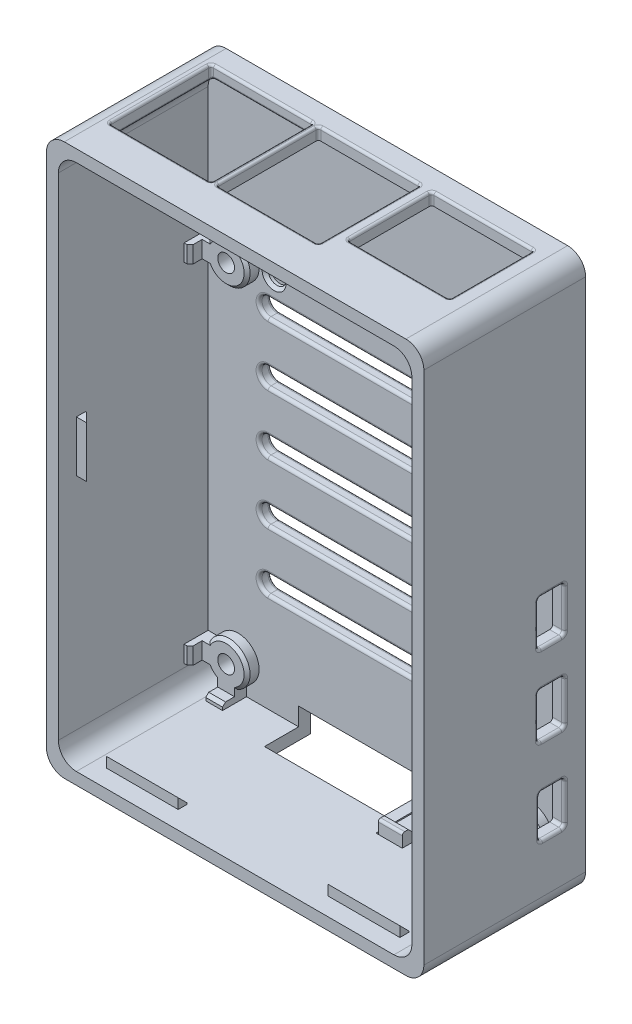
from build123d import *

# Parameters (mm, degrees)
BOSS_EXTRUDE1_DEPTH      = 25
BOSS_EXTRUDE2_START      = -2
BOSS_EXTRUDE2_DEPTH      = 2
CUT_EXTRUDE1_DEPTH       = 2
SKETCH2_24_R             = 1.4
BOSS_EXTRUDE10_DEPTH     = 2
SKETCH2_29_W             = 2.8
SKETCH2_29_H             = 1
SKETCH2_29_W_2           = 1
SKETCH2_29_H_2           = 2.8
BOSS_EXTRUDE13_DEPTH     = 4
CHAMFER4_SIZE            = 0.5
CHAMFER5_SIZE            = 0.5
FILLET2_R                = 0.5
SKETCH2_34_R             = 1.5
CUT_EXTRUDE10_DEPTH      = 1
CHAMFER6_SIZE            = 0.5
SKETCH5_W                = 4
SKETCH5_H                = 3
BOSS_EXTRUDE15_DEPTH     = 2
FILLET4_R                = 0.4
CHAMFER8_SIZE            = 2
CUT_EXTRUDE12_DEPTH      = 1.5
CUT_EXTRUDE12_DEPTH_BACK = 4
SKETCH5_6_W              = 0.2
SKETCH5_6_H              = 2
CUT_EXTRUDE15_DEPTH      = 3
CUT_EXTRUDE15_DEPTH_BACK = 4
SKETCH5_10_W             = 20
SKETCH5_10_H             = 5.7
SKETCH5_10_H_2           = 2
CUT_EXTRUDE16_DEPTH      = 4
CUT_EXTRUDE16_DEPTH_BACK = 4
SKETCH6_W                = 17
SKETCH6_H                = 14
SKETCH6_H_2              = 17
FILLET6_R                = 0.4
CUT_EXTRUDE18_DEPTH      = 4
CUT_EXTRUDE18_DEPTH_BACK = 4
SKETCH7_W                = 7.4
SKETCH7_H                = 4.4
FILLET7_R                = 0.5
SKETCH10_W               = 8.5
SKETCH10_H               = 1.5
BOSS_EXTRUDE18_DEPTH     = 4
SKETCH7_6_W              = 8.5
SKETCH7_6_H              = 1.5
BOSS_EXTRUDE19_DEPTH     = 4
SKETCH6_3_W              = 12
SKETCH6_3_H              = 1.5
BOSS_EXTRUDE20_DEPTH     = 4
SKETCH5_11_W             = 12
SKETCH5_11_H             = 1.5
BOSS_EXTRUDE21_DEPTH     = 2
CHAMFER9_SIZE            = 1.8


# Some blends are built 0.0001 mm under size
with BuildPart() as part:
    # Sketch2 → Boss-Extrude1 (new body)
    with BuildSketch(Plane(origin=(0, 0, 0), x_dir=(0, 1, 0), z_dir=(0, 0, 1))):
        with BuildLine():
            Line((0.99045979, 60.9958194), (86.99045979, 60.9958194))
            ThreePointArc((86.99045979, 60.9958194), (89.111780134, 60.117139744), (89.99045979, 57.9958194))
            Line((89.99045979, 57.9958194), (89.99045979, 0.9958194))
            ThreePointArc((89.99045979, 0.9958194), (89.111780134, -1.125500943), (86.99045979, -2.0041806))
            Line((86.99045979, -2.0041806), (0.99045979, -2.0041806))
            ThreePointArc((0.99045979, -2.0041806), (-1.130860553, -1.125500943), (-2.00954021, 0.9958194))
            Line((-2.00954021, 0.9958194), (-2.00954021, 57.9958194))
            ThreePointArc((-2.00954021, 57.9958194), (-1.130860553, 60.117139744), (0.99045979, 60.9958194))
        make_face()
        with BuildLine():
            Line((2.99045979, 58.9958194), (84.99045979, 58.9958194))
            ThreePointArc((84.99045979, 58.9958194), (87.111780134, 58.117139744), (87.99045979, 55.9958194))
            Line((87.99045979, 55.9958194), (87.99045979, 2.9958194))
            ThreePointArc((87.99045979, 2.9958194), (87.111780134, 0.874499057), (84.99045979, -0.0041806))
            Line((84.99045979, -0.0041806), (2.99045979, -0.0041806))
            ThreePointArc((2.99045979, -0.0041806), (0.869139447, 0.874499057), (-0.00954021, 2.9958194))
            Line((-0.00954021, 2.9958194), (-0.00954021, 55.9958194))
            ThreePointArc((-0.00954021, 55.9958194), (0.869139447, 58.117139744), (2.99045979, 58.9958194))
        make_face(mode=Mode.SUBTRACT)
    extrude(amount=BOSS_EXTRUDE1_DEPTH)

    # Sketch2<6> → Boss-Extrude2 (add)
    with BuildSketch(Plane(origin=(0, 0, 0), x_dir=(0, 1, 0), z_dir=(0, 0, 1)).offset(BOSS_EXTRUDE2_START)):
        with BuildLine():
            Line((0.99045979, 60.9958194), (86.99045979, 60.9958194))
            ThreePointArc((86.99045979, 60.9958194), (89.111780134, 60.117139744), (89.99045979, 57.9958194))
            Line((89.99045979, 57.9958194), (89.99045979, 0.9958194))
            ThreePointArc((89.99045979, 0.9958194), (89.111780134, -1.125500943), (86.99045979, -2.0041806))
            Line((86.99045979, -2.0041806), (0.99045979, -2.0041806))
            ThreePointArc((0.99045979, -2.0041806), (-1.130860553, -1.125500943), (-2.00954021, 0.9958194))
            Line((-2.00954021, 0.9958194), (-2.00954021, 57.9958194))
            ThreePointArc((-2.00954021, 57.9958194), (-1.130860553, 60.117139744), (0.99045979, 60.9958194))
        make_face()
    extrude(amount=BOSS_EXTRUDE2_DEPTH)

    # Sketch2<7> → Cut-Extrude1 (cut)
    with BuildSketch(Plane(origin=(0, 0, 0), x_dir=(0, 1, 0), z_dir=(0, 0, 1))):
        with BuildLine():
            Line((69.49045979, 48.9958194), (69.49045979, 9.9958194))
            ThreePointArc((69.49045979, 9.9958194), (67.99045979, 8.4958194), (66.49045979, 9.9958194))
            Line((66.49045979, 9.9958194), (66.49045979, 48.9958194))
            ThreePointArc((66.49045979, 48.9958194), (67.99045979, 50.4958194), (69.49045979, 48.9958194))
        make_face()
        with BuildLine():
            Line((56.49045979, 48.9958194), (56.49045979, 9.9958194))
            ThreePointArc((56.49045979, 9.9958194), (57.99045979, 8.4958194), (59.49045979, 9.9958194))
            Line((59.49045979, 9.9958194), (59.49045979, 48.9958194))
            ThreePointArc((59.49045979, 48.9958194), (57.99045979, 50.4958194), (56.49045979, 48.9958194))
        make_face()
        with BuildLine():
            Line((49.49045979, 48.9958194), (49.49045979, 9.9958194))
            ThreePointArc((49.49045979, 9.9958194), (47.99045979, 8.4958194), (46.49045979, 9.9958194))
            Line((46.49045979, 9.9958194), (46.49045979, 48.9958194))
            ThreePointArc((46.49045979, 48.9958194), (47.99045979, 50.4958194), (49.49045979, 48.9958194))
        make_face()
        with BuildLine():
            Line((36.49045979, 48.9958194), (36.49045979, 9.9958194))
            ThreePointArc((36.49045979, 9.9958194), (37.99045979, 8.4958194), (39.49045979, 9.9958194))
            Line((39.49045979, 9.9958194), (39.49045979, 48.9958194))
            ThreePointArc((39.49045979, 48.9958194), (37.99045979, 50.4958194), (36.49045979, 48.9958194))
        make_face()
        with BuildLine():
            Line((29.49045979, 48.9958194), (29.49045979, 9.9958194))
            ThreePointArc((29.49045979, 9.9958194), (27.99045979, 8.4958194), (26.49045979, 9.9958194))
            Line((26.49045979, 9.9958194), (26.49045979, 48.9958194))
            ThreePointArc((26.49045979, 48.9958194), (27.99045979, 50.4958194), (29.49045979, 48.9958194))
        make_face()
        with BuildLine():
            Line((16.49045979, 48.9958194), (16.49045979, 9.9958194))
            ThreePointArc((16.49045979, 9.9958194), (17.99045979, 8.4958194), (19.49045979, 9.9958194))
            Line((19.49045979, 9.9958194), (19.49045979, 48.9958194))
            ThreePointArc((19.49045979, 48.9958194), (17.99045979, 50.4958194), (16.49045979, 48.9958194))
        make_face()
    extrude(amount=-CUT_EXTRUDE1_DEPTH, mode=Mode.SUBTRACT)

    # Sketch2<24> → Boss-Extrude10 (add)
    # profile 1 of 4: a face of its own
    with BuildSketch(Plane(origin=(0, 0, 0), x_dir=(0, 1, 0), z_dir=(0, 0, 1))):
        with BuildLine():
            Line((6.39045979, 57.9958194), (3.59045979, 57.9958194))
            Line((3.59045979, 57.9958194), (3.59045979, 57.203622387))
            ThreePointArc((3.59045979, 57.203622387), (2.515586056, 56.470693134), (1.782656804, 55.3958194))
            Line((1.782656804, 55.3958194), (0.99045979, 55.3958194))
            Line((0.99045979, 55.3958194), (0.99045979, 52.5958194))
            Line((0.99045979, 52.5958194), (1.782656804, 52.5958194))
            ThreePointArc((1.782656804, 52.5958194), (7.465333524, 51.520945666), (6.39045979, 57.203622387))
            Line((6.39045979, 57.203622387), (6.39045979, 57.9958194))
        make_face()
        with Locations(Location((4.99045979, 53.9958194, 0), (0, 0, 270))):
            Circle(SKETCH2_24_R, mode=Mode.SUBTRACT)
    # profile 2 of 4: a face of its own
    with BuildSketch(Plane(origin=(0, 0, 0), x_dir=(0, 1, 0), z_dir=(0, 0, 1))):
        with BuildLine():
            Line((64.39045979, 57.9958194), (61.59045979, 57.9958194))
            Line((61.59045979, 57.9958194), (61.59045979, 57.203622387))
            ThreePointArc((61.59045979, 57.203622387), (62.99045979, 50.4958194), (64.39045979, 57.203622387))
            Line((64.39045979, 57.203622387), (64.39045979, 57.9958194))
        make_face()
        with Locations(Location((62.99045979, 53.9958194, 0), (0, 0, 270))):
            Circle(SKETCH2_24_R, mode=Mode.SUBTRACT)
    # profile 3 of 4: a face of its own
    with BuildSketch(Plane(origin=(0, 0, 0), x_dir=(0, 1, 0), z_dir=(0, 0, 1))):
        with BuildLine():
            Line((61.59045979, 0.9958194), (64.39045979, 0.9958194))
            Line((64.39045979, 0.9958194), (64.39045979, 1.788016414))
            ThreePointArc((64.39045979, 1.788016414), (62.99045979, 8.4958194), (61.59045979, 1.788016414))
            Line((61.59045979, 1.788016414), (61.59045979, 0.9958194))
        make_face()
        with Locations(Location((62.99045979, 4.9958194, 0), (0, 0, 270))):
            Circle(SKETCH2_24_R, mode=Mode.SUBTRACT)
    # profile 4 of 4: a face of its own
    with BuildSketch(Plane(origin=(0, 0, 0), x_dir=(0, 1, 0), z_dir=(0, 0, 1))):
        with BuildLine():
            Line((1.782656804, 6.3958194), (0.99045979, 6.3958194))
            Line((0.99045979, 6.3958194), (0.99045979, 3.5958194))
            Line((0.99045979, 3.5958194), (1.782656804, 3.5958194))
            ThreePointArc((1.782656804, 3.5958194), (2.515586056, 2.520945666), (3.59045979, 1.788016414))
            Line((3.59045979, 1.788016414), (3.59045979, 0.9958194))
            Line((3.59045979, 0.9958194), (6.39045979, 0.9958194))
            Line((6.39045979, 0.9958194), (6.39045979, 1.788016414))
            ThreePointArc((6.39045979, 1.788016414), (7.465333524, 7.470693134), (1.782656804, 6.3958194))
        make_face()
        with Locations(Location((4.99045979, 4.9958194, 0), (0, 0, 270))):
            Circle(SKETCH2_24_R, mode=Mode.SUBTRACT)
    extrude(amount=BOSS_EXTRUDE10_DEPTH)

    # Sketch2<29> → Boss-Extrude13 (add)
    with BuildSketch(Plane(origin=(0, 0, 0), x_dir=(0, 1, 0), z_dir=(0, 0, 1))):
        with Locations((4.99045979, 58.4958194)):
            Rectangle(SKETCH2_29_W, SKETCH2_29_H)
        with Locations((0.49045979, 53.9958194)):
            Rectangle(SKETCH2_29_W_2, SKETCH2_29_H_2)
        with Locations((0.49045979, 4.9958194)):
            Rectangle(SKETCH2_29_W_2, SKETCH2_29_H_2)
        with Locations((4.99045979, 0.4958194)):
            Rectangle(SKETCH2_29_W, SKETCH2_29_H)
        with Locations((62.99045979, 0.4958194)):
            Rectangle(SKETCH2_29_W, SKETCH2_29_H)
        with Locations((62.99045979, 58.4958194)):
            Rectangle(SKETCH2_29_W, SKETCH2_29_H)
    extrude(amount=BOSS_EXTRUDE13_DEPTH)

    # Chamfer4
    chamfer4_edges = [part.edges().sort_by_distance(p)[0] for p in [
        (-57.9958194, 62.99045979, 4),
        (-0.9958194, 62.99045979, 4),
        (-0.9958194, 4.99045979, 4),
        (-4.9958194, 0.99045979, 4),
        (-53.9958194, 0.99045979, 4),
        (-57.9958194, 4.99045979, 4),
    ]]
    chamfer(chamfer4_edges, length=CHAMFER4_SIZE)

    # Chamfer5
    chamfer5_edges = [part.edges().sort_by_distance(p)[0] for p in [
        (-7.470693134, 7.465333524, 2),
        (-2.520945666, 2.515586056, 2),
        (-8.4958194, 62.99045979, 2),
        (-50.4958194, 62.99045979, 2),
        (-51.520945666, 7.465333524, 2),
        (-56.470693134, 2.515586056, 2),
    ]]
    chamfer(chamfer5_edges, length=CHAMFER5_SIZE)

    # Fillet2
    fillet2_edges = [part.edges().sort_by_distance(p)[0] for p in [
        (-50.4958194, 67.99045979, -2),
        (-29.4958194, 69.49045979, 0),
        (-8.4958194, 67.99045979, -2),
        (-29.4958194, 66.49045979, -2),
        (-29.4958194, 69.49045979, -2),
        (-50.4958194, 67.99045979, 0),
        (-29.4958194, 66.49045979, 0),
        (-8.4958194, 67.99045979, 0),
        (-50.4958194, 57.99045979, 0),
        (-29.4958194, 59.49045979, 0),
        (-8.4958194, 57.99045979, 0),
        (-29.4958194, 56.49045979, -2),
        (-50.4958194, 57.99045979, -2),
        (-29.4958194, 59.49045979, -2),
        (-8.4958194, 57.99045979, -2),
        (-29.4958194, 56.49045979, 0),
        (-50.4958194, 47.99045979, -2),
        (-29.4958194, 49.49045979, 0),
        (-8.4958194, 47.99045979, -2),
        (-29.4958194, 46.49045979, -2),
        (-29.4958194, 49.49045979, -2),
        (-50.4958194, 47.99045979, 0),
        (-29.4958194, 46.49045979, 0),
        (-8.4958194, 47.99045979, 0),
        (-50.4958194, 37.99045979, 0),
        (-29.4958194, 39.49045979, 0),
        (-8.4958194, 37.99045979, 0),
        (-29.4958194, 36.49045979, -2),
        (-50.4958194, 37.99045979, -2),
        (-29.4958194, 39.49045979, -2),
        (-8.4958194, 37.99045979, -2),
        (-29.4958194, 36.49045979, 0),
        (-50.4958194, 27.99045979, -2),
        (-29.4958194, 29.49045979, 0),
        (-8.4958194, 27.99045979, -2),
        (-29.4958194, 26.49045979, -2),
        (-29.4958194, 29.49045979, -2),
        (-50.4958194, 27.99045979, 0),
        (-29.4958194, 26.49045979, 0),
        (-8.4958194, 27.99045979, 0),
        (-50.4958194, 17.99045979, 0),
        (-29.4958194, 19.49045979, 0),
        (-8.4958194, 17.99045979, 0),
        (-29.4958194, 16.49045979, -2),
        (-50.4958194, 17.99045979, -2),
        (-29.4958194, 19.49045979, -2),
        (-8.4958194, 17.99045979, -2),
        (-29.4958194, 16.49045979, 0),
    ]]
    fillet(fillet2_edges, radius=FILLET2_R)

    # Sketch2<34> → Cut-Extrude10 (cut)
    with BuildSketch(Plane(origin=(0, 0, 0), x_dir=(0, 1, 0), z_dir=(0, 0, 1))):
        with Locations(Location((4.99045979, 10.9958194, 0), (0, 0, 270))):
            Circle(SKETCH2_34_R)
        with Locations(Location((62.99045979, 47.9958194, 0), (0, 0, 270))):
            Circle(SKETCH2_34_R)
    extrude(amount=-CUT_EXTRUDE10_DEPTH, mode=Mode.SUBTRACT)

    # Chamfer6
    chamfer6_edges = [part.edges().sort_by_distance(p)[0] for p in [
        (-12.4958194, 4.99045979, 0),
        (-49.4958194, 62.99045979, 0),
    ]]
    chamfer(chamfer6_edges, length=CHAMFER6_SIZE)

    # Sketch5 → Boss-Extrude15 (add)
    with BuildSketch(Plane(origin=(0, -0.00954021, 0), x_dir=(-1, 0, 0), z_dir=(0, 1, 0))):
        with Locations((19.8958194, 7.2)):
            Rectangle(SKETCH5_W, SKETCH5_H)
    extrude(amount=BOSS_EXTRUDE15_DEPTH)

    # Fillet4
    fillet4_edges = [part.edges().sort_by_distance(p)[0] for p in [
        (-19.8958194, 1.99045979, 8.7),
    ]]
    fillet(fillet4_edges, radius=FILLET4_R)

    # Chamfer8
    chamfer8_edges = [part.edges().sort_by_distance(p)[0] for p in [
        (-19.8958194, 1.99045979, 5.7),
    ]]
    chamfer(chamfer8_edges, length=CHAMFER8_SIZE - 0.0001)  # a hair under: the kernel refuses the full size

    # Sketch5<6> → Cut-Extrude12 (cut, two sides: drawn at the far end of the back side and taken through both)
    with BuildSketch(Plane(origin=(0, -0.00954021, 0), x_dir=(-1, 0, 0), z_dir=(0, 1, 0)).offset(-CUT_EXTRUDE12_DEPTH_BACK)):
        with Locations((21.9958194, -1)):
            Rectangle(SKETCH5_6_W, SKETCH5_6_H)
        with Locations((17.7958194, -1)):
            Rectangle(SKETCH5_6_W, SKETCH5_6_H)
        Polygon((17.8958194, 0), (17.8958194, 5.7), (17.8958194, 8.7), (21.8958194, 8.7), (21.8958194, 5.7), (21.8958194, 0), (22.0958194, 0), (22.0958194, 8.9), (17.6958194, 8.9), (17.6958194, 0), align=None)
    extrude(amount=CUT_EXTRUDE12_DEPTH + CUT_EXTRUDE12_DEPTH_BACK, mode=Mode.SUBTRACT)

    # Sketch5<10> → Cut-Extrude15 (cut, two sides: drawn at the far end of the back side and taken through both)
    with BuildSketch(Plane(origin=(0, -0.00954021, 0), x_dir=(-1, 0, 0), z_dir=(0, 1, 0)).offset(-CUT_EXTRUDE15_DEPTH_BACK)):
        with Locations((33.8958194, 2.85)):
            Rectangle(SKETCH5_10_W, SKETCH5_10_H)
        with Locations((33.8958194, -1)):
            Rectangle(SKETCH5_10_W, SKETCH5_10_H_2)
    extrude(amount=CUT_EXTRUDE15_DEPTH + CUT_EXTRUDE15_DEPTH_BACK, mode=Mode.SUBTRACT)

    # Sketch6 → Cut-Extrude16 (cut, two sides: drawn at the far end of the back side and taken through both)
    with BuildSketch(Plane(origin=(0, 89.99045979, 0), x_dir=(-1, 0, 0), z_dir=(0, 1, 0)).offset(-CUT_EXTRUDE16_DEPTH_BACK)):
        with Locations((11.6958194, 8.5)):
            Rectangle(SKETCH6_W, SKETCH6_H)
        with Locations((30.5958194, 10)):
            Rectangle(SKETCH6_W, SKETCH6_H_2)
        with Locations((48.4958194, 10)):
            Rectangle(SKETCH6_W, SKETCH6_H_2)
    extrude(amount=CUT_EXTRUDE16_DEPTH + CUT_EXTRUDE16_DEPTH_BACK, mode=Mode.SUBTRACT)

    # Fillet6
    fillet6_edges = [part.edges().sort_by_distance(p)[0] for p in [
        (-56.9958194, 88.904673353, 18.5),
        (-39.9958194, 88.99045979, 18.5),
        (-39.9958194, 88.99045979, 1.5),
        (-56.9958194, 88.904673353, 1.5),
        (-39.0958194, 88.99045979, 1.5),
        (-39.0958194, 88.99045979, 18.5),
        (-22.0958194, 88.99045979, 18.5),
        (-22.0958194, 88.99045979, 1.5),
        (-3.1958194, 88.99045979, 15.5),
        (-20.1958194, 88.99045979, 15.5),
        (-20.1958194, 88.99045979, 1.5),
        (-3.1958194, 88.99045979, 1.5),
    ]]
    fillet(fillet6_edges, radius=FILLET6_R)
    fillet6_2_edges = [part.edges().sort_by_distance(p)[0] for p in [
        (-56.9958194, 87.818886915, 10),
        (-56.297346286, 87.975268249, 18.5),
        (-56.297346286, 87.975268249, 1.5),
        (-48.1958194, 87.99045979, 18.5),
        (-39.9958194, 89.99045979, 10),
        (-48.1958194, 87.99045979, 1.5),
        (-56.9958194, 89.99045979, 10),
        (-11.6958194, 89.99045979, 1.5),
        (-39.9958194, 87.99045979, 10),
        (-48.4958194, 89.99045979, 18.5),
        (-48.4958194, 89.99045979, 1.5),
        (-39.0958194, 89.99045979, 10),
        (-30.5958194, 89.99045979, 1.5),
        (-22.0958194, 89.99045979, 10),
        (-30.5958194, 89.99045979, 18.5),
        (-20.1958194, 89.99045979, 8.5),
        (-11.6958194, 89.99045979, 15.5),
        (-3.1958194, 89.99045979, 8.5),
        (-3.312976688, 89.99045979, 1.617157288),
        (-3.312976688, 89.99045979, 15.382842712),
        (-20.078662113, 89.99045979, 15.382842712),
        (-20.078662113, 89.99045979, 1.617157288),
        (-38.978662113, 89.99045979, 18.382842712),
        (-22.212976688, 89.99045979, 18.382842712),
        (-22.212976688, 89.99045979, 1.617157288),
        (-38.978662113, 89.99045979, 1.617157288),
        (-40.112976688, 89.99045979, 1.617157288),
        (-56.878662113, 89.99045979, 1.617157288),
        (-56.878662113, 89.99045979, 18.382842712),
        (-40.112976688, 89.99045979, 18.382842712),
        (-40.112976688, 87.99045979, 18.382842712),
        (-40.112976688, 87.99045979, 1.617157288),
        (-56.882094543, 87.856557549, 1.62063189),
        (-56.882094543, 87.856557549, 18.37936811),
    ]]
    fillet(fillet6_2_edges, radius=FILLET6_R)

    # Sketch7 → Cut-Extrude18 (cut, two sides: drawn at the far end of the back side and taken through both)
    with BuildSketch(Plane.YZ.offset(2.0041806).offset(-CUT_EXTRUDE18_DEPTH_BACK)):
        Polygon((9.19045979, 1.5), (9.19045979, 5.7), (13.894344909, 5.7), (16.19045979, 5.7), (16.19045979, 1.5), align=None)
        with Locations((27.29045979, 3.7)):
            Rectangle(SKETCH7_W, SKETCH7_H)
        with Locations((40.69045979, 3.7)):
            Rectangle(SKETCH7_W, SKETCH7_H)
    extrude(amount=CUT_EXTRUDE18_DEPTH + CUT_EXTRUDE18_DEPTH_BACK, mode=Mode.SUBTRACT)

    # Fillet7
    fillet7_edges = [part.edges().sort_by_distance(p)[0] for p in [
        (2.0041806, 9.19045979, 3.6),
        (1.0041806, 9.19045979, 5.7),
        (2.0041806, 12.69045979, 1.5),
        (1.0041806, 9.19045979, 1.5),
        (2.0041806, 16.19045979, 3.6),
        (1.0041806, 16.19045979, 1.5),
        (2.0041806, 12.69045979, 5.7),
        (1.0041806, 16.19045979, 5.7),
        (2.0041806, 30.99045979, 3.7),
        (1.0041806, 30.99045979, 1.5),
        (2.0041806, 27.29045979, 5.9),
        (1.0041806, 30.99045979, 5.9),
        (1.0041806, 23.59045979, 5.9),
        (1.0041806, 23.59045979, 1.5),
        (2.0041806, 23.59045979, 3.7),
        (2.0041806, 27.29045979, 1.5),
        (2.0041806, 44.39045979, 3.7),
        (1.0041806, 44.39045979, 1.5),
        (2.0041806, 40.69045979, 5.9),
        (1.0041806, 44.39045979, 5.9),
        (1.0041806, 36.99045979, 5.9),
        (1.0041806, 36.99045979, 1.5),
        (2.0041806, 36.99045979, 3.7),
        (2.0041806, 40.69045979, 1.5),
    ]]
    fillet(fillet7_edges, radius=FILLET7_R)

    # Sketch10 → Boss-Extrude18 (add)
    with BuildSketch(Plane(origin=(-60.9958194, 0, 0), x_dir=(0, -1, 0), z_dir=(-1, 0, 0))):
        with Locations((-43.99045979, 21.25)):
            Rectangle(SKETCH10_W, SKETCH10_H)
    extrude(amount=-BOSS_EXTRUDE18_DEPTH)

    # Sketch7<6> → Boss-Extrude19 (add)
    with BuildSketch(Plane.YZ.offset(2.0041806)):
        with Locations((43.99045979, 21.25)):
            Rectangle(SKETCH7_6_W, SKETCH7_6_H)
    extrude(amount=-BOSS_EXTRUDE19_DEPTH)

    # Sketch6<3> → Boss-Extrude20 (add)
    with BuildSketch(Plane(origin=(0, 89.99045979, 0), x_dir=(-1, 0, 0), z_dir=(0, 1, 0))):
        with Locations((47.9958194, 21.25)):
            Rectangle(SKETCH6_3_W, SKETCH6_3_H)
        with Locations((10.9958194, 21.25)):
            Rectangle(SKETCH6_3_W, SKETCH6_3_H)
    extrude(amount=-BOSS_EXTRUDE20_DEPTH)

    # Sketch5<11> → Boss-Extrude21 (add)
    with BuildSketch(Plane(origin=(0, -0.00954021, 0), x_dir=(-1, 0, 0), z_dir=(0, 1, 0))):
        with Locations((10.9958194, 21.25)):
            Rectangle(SKETCH5_11_W, SKETCH5_11_H)
        with Locations((47.9958194, 21.25)):
            Rectangle(SKETCH5_11_W, SKETCH5_11_H)
    extrude(amount=BOSS_EXTRUDE21_DEPTH)

    # Chamfer9
    # the kernel refuses this chamfer: 1.8 mm, written as the material it takes off along each edge
    with BuildSketch(Plane(origin=(-56.9958194, 35.111430412, 20.5), x_dir=(-0.9996219169112966, 0, -0.027495876610586487), z_dir=(0, 1, 0)), Plane(origin=(-1.9958194, 52.869489169, 20.5), x_dir=(0.9996219169112966, 0, -0.02749587661058639), z_dir=(0, -1, 0))) as chamfer9_piece_1:
        Polygon((CHAMFER9_SIZE * 0.999621916911, CHAMFER9_SIZE * 0.0274958766106), (-CHAMFER9_SIZE * 0.0274958766106, CHAMFER9_SIZE * 0.999621916911), (0, 0), align=None)
    extrude(amount=17.758058757, mode=Mode.SUBTRACT)
    with BuildSketch(Plane(origin=(-53.9958194, 85.99045979, 20.5), x_dir=(0, 0.9996219169112966, -0.027495876610586382), z_dir=(1, 0, 0))) as chamfer9_piece_2:
        Polygon((CHAMFER9_SIZE * 0.999621916911, CHAMFER9_SIZE * 0.0274958766106), (-CHAMFER9_SIZE * 0.0274958766106, CHAMFER9_SIZE * 0.999621916911), (0, 0), align=None)
    extrude(amount=16.629029378, mode=Mode.SUBTRACT)
    with BuildSketch(Plane(origin=(-4.9958194, 85.99045979, 20.5), x_dir=(0, 0.9996219169112966, -0.027495876610586382), z_dir=(-1, 0, 0)), Plane(origin=(-21.624848779, 1.99045979, 20.5), x_dir=(0, -0.9996219169112969, -0.027495876610586396), z_dir=(1, 0, 0)), Plane(origin=(-53.9958194, 1.99045979, 20.5), x_dir=(0, -0.9996219169112969, -0.027495876610586396), z_dir=(1, 0, 0))) as chamfer9_piece_3:
        Polygon((CHAMFER9_SIZE * 0.999621916911, -CHAMFER9_SIZE * 0.0274958766106), (-CHAMFER9_SIZE * 0.0274958766106, -CHAMFER9_SIZE * 0.999621916911), (0, 0), align=None)
    extrude(amount=16.629029378, mode=Mode.SUBTRACT)


solid = part.part
